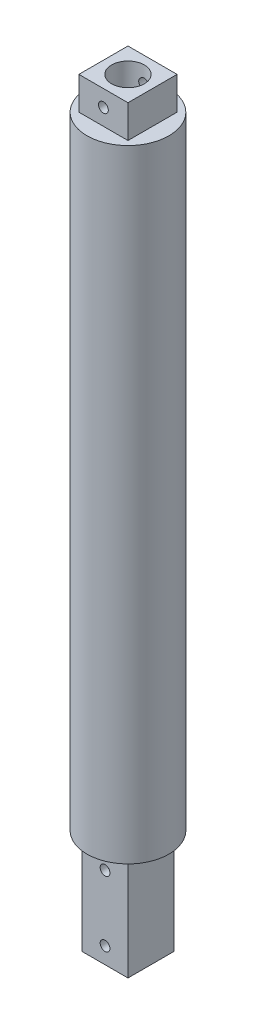
from build123d import *

# Parameters (mm, degrees)
SKETCH1_W           = 14
SKETCH1_H           = 32
SKETCH1_R           = 1.5
BOSS_EXTRUDE1_DEPTH = 7
SKETCH3_R           = 12.5
BOSS_EXTRUDE2_DEPTH = 200
SKETCH4_OUTSIDE_W   = 73.936
SKETCH4_OUTSIDE_H   = 73.936
SKETCH4_OUTSIDE_W_2 = 15
SKETCH4_OUTSIDE_H_2 = 15
CUT_EXTRUDE1_DEPTH  = 10
SKETCH5_R           = 1.5
CUT_EXTRUDE2_DEPTH  = 234.195733237
SKETCH6_R           = 5
CUT_EXTRUDE3_DEPTH  = 233.672516641


with BuildPart() as part:
    # Sketch1 → Boss-Extrude1 (new, symmetric)
    with BuildSketch(Plane.XY):
        with Locations((0, 16)):
            Rectangle(SKETCH1_W, SKETCH1_H)
        with Locations((0, 5)):
            Circle(SKETCH1_R, mode=Mode.SUBTRACT)
        with Locations((0, 25)):
            Circle(SKETCH1_R, mode=Mode.SUBTRACT)
    extrude(amount=BOSS_EXTRUDE1_DEPTH, both=True)

    # Sketch3 → Boss-Extrude2 (add)
    with BuildSketch(Plane(origin=(0, 32, 0), x_dir=(1, 0, 0), z_dir=(0, 1, 0))):
        Circle(SKETCH3_R)
    extrude(amount=BOSS_EXTRUDE2_DEPTH)

    # Sketch4 outside → Cut-Extrude1 (cut)
    with BuildSketch(Plane(origin=(0, 232, 0), x_dir=(1, 0, 0), z_dir=(0, 1, 0))):
        Rectangle(SKETCH4_OUTSIDE_W, SKETCH4_OUTSIDE_H)
        Rectangle(SKETCH4_OUTSIDE_W_2, SKETCH4_OUTSIDE_H_2, mode=Mode.SUBTRACT)
    extrude(amount=-CUT_EXTRUDE1_DEPTH, mode=Mode.SUBTRACT)

    # Sketch5 → Cut-Extrude2 (cut, through all)
    with BuildSketch(Plane.XY.offset(7.5)):
        with Locations((0, 227)):
            Circle(SKETCH5_R)
    extrude(amount=-CUT_EXTRUDE2_DEPTH, mode=Mode.SUBTRACT)

    # Sketch6 → Cut-Extrude3 (cut, through all)
    with BuildSketch(Plane.XZ):
        Circle(SKETCH6_R)
    extrude(amount=-CUT_EXTRUDE3_DEPTH, mode=Mode.SUBTRACT)


solid = part.part
